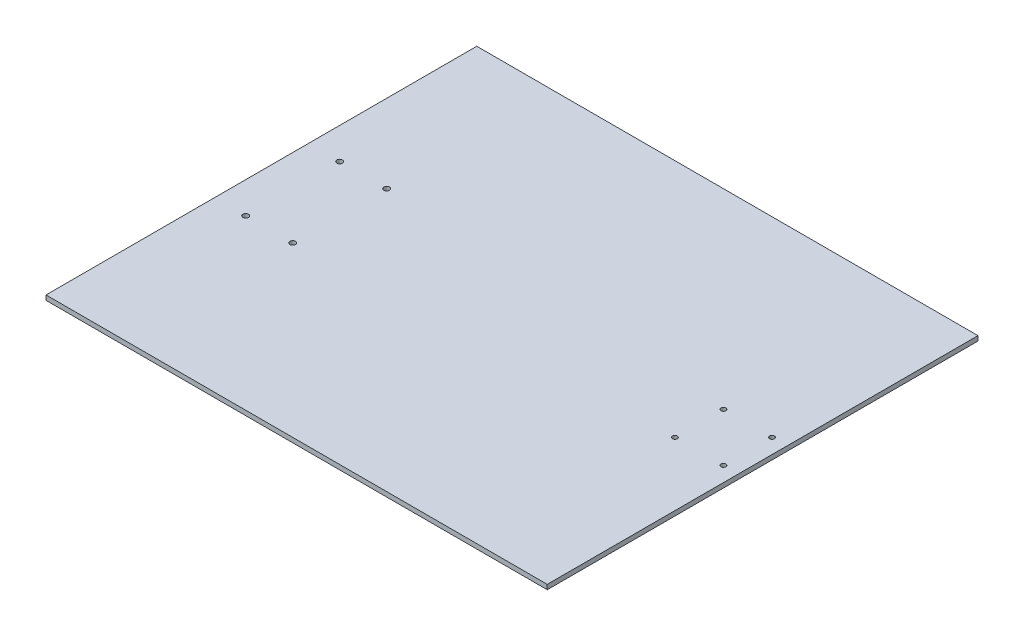
from build123d import *

# Parameters (mm, degrees)
SKETCH1_W                      = 320
SKETCH1_H                      = 275
BOSS_EXTRUDE1_DEPTH            = 3
TALADRO_DE_MARGEN_PARA_M2_51_D = 3.1
TALADRO_DE_MARGEN_PARA_M32_D   = 3.6


with BuildPart() as part:
    # Sketch1 → Boss-Extrude1 (new body)
    with BuildSketch(Plane(origin=(0, 0, 0), x_dir=(1, 0, 0), z_dir=(0, 1, 0))):
        Rectangle(SKETCH1_W, SKETCH1_H)
    extrude(amount=BOSS_EXTRUDE1_DEPTH)

    # Taladro de margen para M2.51 (through all)
    with Locations(Plane(origin=(0, 3, 0), x_dir=(1, 0, 0), z_dir=(0, 1, 0))):
        with Locations((150.5, 15.5), (150.5, -15.5), (119.5, -15.5), (119.5, 15.5)):
            Hole(TALADRO_DE_MARGEN_PARA_M2_51_D / 2)

    # Taladro de margen para M32 (through all)
    with Locations(Plane(origin=(0, 3, 0), x_dir=(1, 0, 0), z_dir=(0, 1, 0))):
        with Locations((-110, 30), (-110, -30), (-140, -30), (-140, 30)):
            Hole(TALADRO_DE_MARGEN_PARA_M32_D / 2)


solid = part.part
